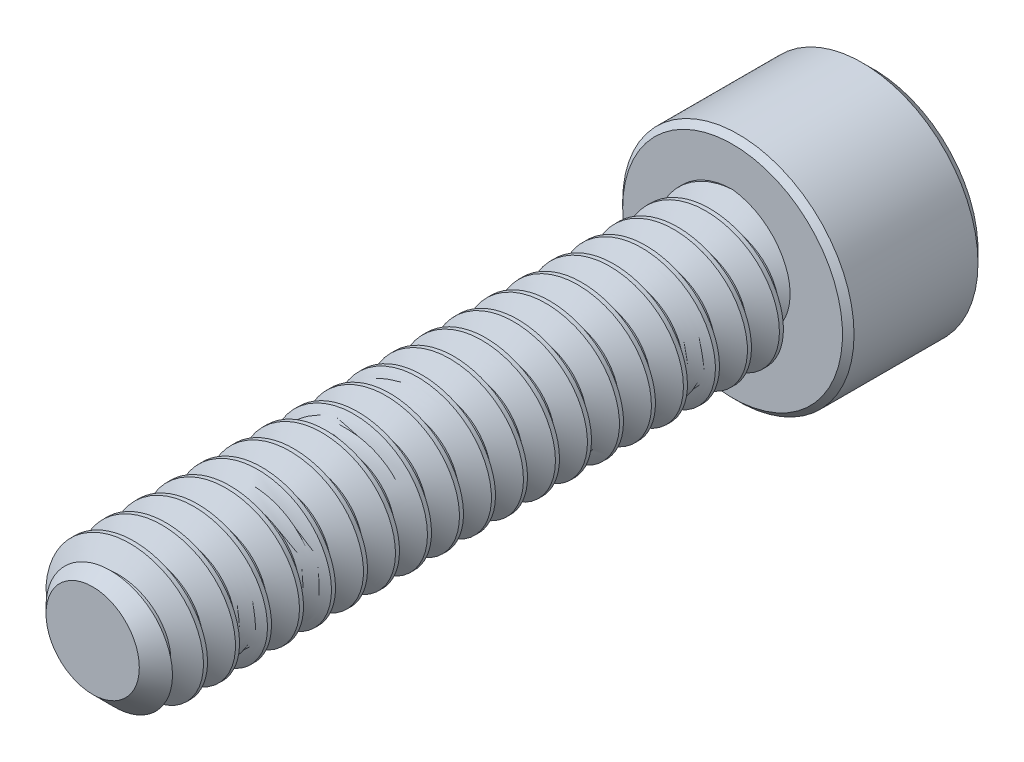
from build123d import *

# Parameters (mm, degrees)
SKETCH1_R          = 1.7526
EXTRUDE1_DEPTH     = 15.875
CHAMFER3_SIZE      = 0.5953125
CUT_SWEEP1_PITCH   = 0.79375
SKETCH6_R          = 2.8702
EXTRUDE2_DEPTH     = 3.5052
CUT_EXTRUDE1_DEPTH = 2.08359375
CHAMFER1_SIZE      = 0.28702
CHAMFER2_SIZE      = 0.14351


with BuildPart() as part:
    # Sketch1 → Extrude1 (new body)
    with BuildSketch(Plane.XY):
        Circle(SKETCH1_R)
    extrude(amount=-EXTRUDE1_DEPTH)

    # Chamfer3
    chamfer3_edges = [part.edges().sort_by_distance(p)[0] for p in [
        (-1.7526, 0, 0),
    ]]
    chamfer(chamfer3_edges, length=CHAMFER3_SIZE)

    # Cut-Sweep1: the profile of Sketch3 profile screwed along a right-hand helix of 21 turns, 6 arcs to a turn; built about Z, then put on its axis
    cut_sweep1_z = Axis((0, 0, 0), (0, 0, 1))
    cut_sweep1_corners = [(1.7529, 0, -0.694704455), (1.237044252, 0, -0.396875), (1.237044252, 0, -0.29765625), (1.7529, 0, 0.000173205)]
    with BuildLine(mode=Mode.PRIVATE) as cut_sweep1_profile:
        Line(cut_sweep1_corners[0], cut_sweep1_corners[1])
        Line(cut_sweep1_corners[1], cut_sweep1_corners[2])
        Line(cut_sweep1_corners[2], cut_sweep1_corners[3])
        Line(cut_sweep1_corners[3], cut_sweep1_corners[0])
    cut_sweep1_cap = Face(cut_sweep1_profile.wire())
    cut_sweep1_turn_angles = [0, 30, 60, 90, 120, 150, 180, 210, 240, 270, 300, 330, 360]
    cut_sweep1_turn_weights = [1, 0.8660254037844387, 1, 0.8660254037844387, 1, 0.8660254037844387, 1, 0.8660254037844387, 1, 0.8660254037844387, 1, 0.8660254037844387, 1]
    cut_sweep1_turn_rails = [Edge.make_bspline([Vector(p[0], p[1], 0).rotate(cut_sweep1_z, cut_sweep1_turn_angles[k]) / cut_sweep1_turn_weights[k] + Vector(0, 0, p[2] + CUT_SWEEP1_PITCH * cut_sweep1_turn_angles[k] / 360) for k in range(13)], [0, 0, 0, 1, 1, 2, 2, 3, 3, 4, 4, 5, 5, 6, 6, 6], 2, cut_sweep1_turn_weights) for p in cut_sweep1_corners]
    cut_sweep1_turn_sides = [Face.make_surface_from_curves(cut_sweep1_turn_rails[p[0]], cut_sweep1_turn_rails[p[1]]) for p in [(0, 1), (1, 2), (2, 3), (3, 0)]]
    cut_sweep1 = Plane(origin=(0, 0, 0), x_dir=(0, 1, 0), z_dir=(0, 0, -1)) * Solid(Shell([*[p.moved(Location((0, 0, CUT_SWEEP1_PITCH * i))) for i in range(21) for p in cut_sweep1_turn_sides], cut_sweep1_cap, cut_sweep1_cap.rotate(cut_sweep1_z, 7560).moved(Location((0, 0, CUT_SWEEP1_PITCH * 7560 / 360)))]))
    add(cut_sweep1, mode=Mode.SUBTRACT)

    # Sketch6 → Extrude2 (add)
    with BuildSketch(Plane(origin=(0, 0, -15.875), x_dir=(-1, 0, 0), z_dir=(0, 0, -1))):
        Circle(SKETCH6_R)
    extrude(amount=EXTRUDE2_DEPTH)

    # Sketch7 → Cut-Extrude1 (cut)
    with BuildSketch(Plane(origin=(0, 0, -19.3802), x_dir=(-1, 0, 0), z_dir=(0, 0, -1))):
        Polygon((0, 1.603951217), (-1.3890625, 0.801975608), (-1.3890625, -0.801975608), (0, -1.603951217), (1.3890625, -0.801975608), (1.3890625, 0.801975608), align=None)
    extrude(amount=-CUT_EXTRUDE1_DEPTH, mode=Mode.SUBTRACT)

    # Cut-Extrude2 cone 1 section (through the dimple's axis) → Cut-Extrude2 (revolve, cut)
    with BuildSketch(Plane(origin=(0, 0, -19.3802), x_dir=(0, 1, 0), z_dir=(1, 0, 0))):
        Polygon((0, 0), (1.603951217, 0), (0, 1.603951217), align=None)
    revolve(axis=Axis((0, 0, -19.3802), (0, 0, 1)), mode=Mode.SUBTRACT)

    # Chamfer1
    chamfer1_edges = [part.edges().sort_by_distance(p)[0] for p in [
        (2.8702, 0, -19.3802),
    ]]
    chamfer(chamfer1_edges, length=CHAMFER1_SIZE)

    # Chamfer2
    chamfer2_edges = [part.edges().sort_by_distance(p)[0] for p in [
        (2.8702, 0, -15.875),
    ]]
    chamfer(chamfer2_edges, length=CHAMFER2_SIZE)


solid = part.part
